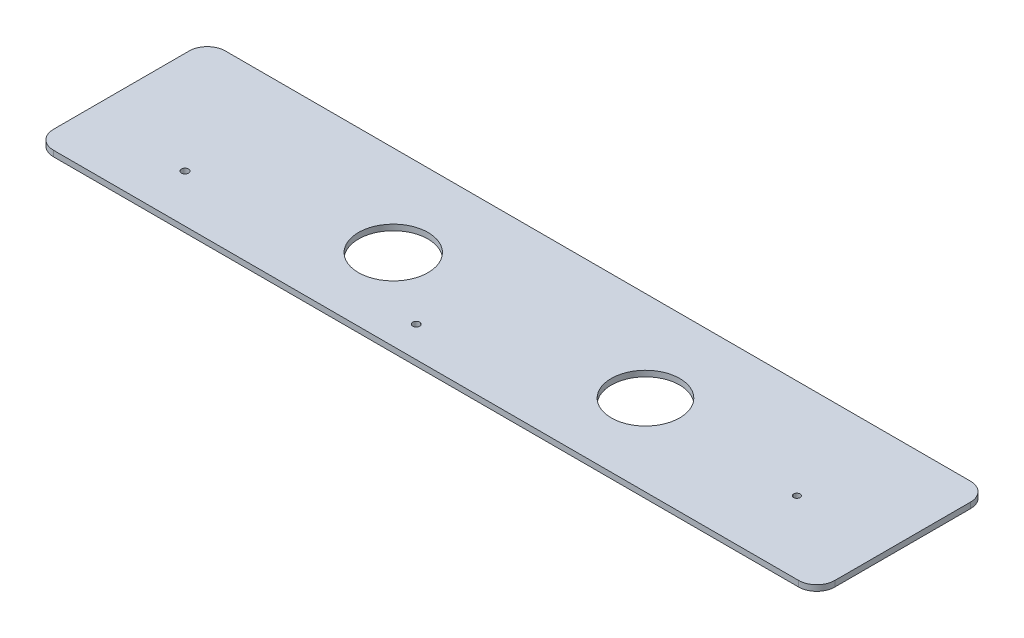
from build123d import *

# Parameters (mm, degrees)
SKETCH1_W           = 431.8
SKETCH1_H           = 95
SKETCH1_R           = 2
SKETCH1_R_2         = 1.94945
SKETCH1_R_3         = 19.23528322
SKETCH1_R_4         = 18.898143468
SKETCH1_R_5         = 1.770184209
BOSS_EXTRUDE1_DEPTH = 3.175
FILLET1_R           = 10


with BuildPart() as part:
    # Sketch1 → Boss-Extrude1 (new body)
    with BuildSketch(Plane(origin=(0, 0, 0), x_dir=(1, 0, 0), z_dir=(0, 1, 0))):
        with Locations((213.767466267, 47.5)):
            Rectangle(SKETCH1_W, SKETCH1_H)
        with Locations((54.191771613, 26.368316596)):
            Circle(SKETCH1_R, mode=Mode.SUBTRACT)
        with Locations((191.365563911, 16.995054431)):
            Circle(SKETCH1_R_2, mode=Mode.SUBTRACT)
        with Locations((150.735788138, 44.916344224)):
            Circle(SKETCH1_R_3, mode=Mode.SUBTRACT)
        with Locations((290.116990511, 44.912341135)):
            Circle(SKETCH1_R_4, mode=Mode.SUBTRACT)
        with Locations((378.667466267, 40.050297191)):
            Circle(SKETCH1_R_5, mode=Mode.SUBTRACT)
    extrude(amount=BOSS_EXTRUDE1_DEPTH)

    # Fillet1
    fillet1_edges = [part.edges().sort_by_distance(p)[0] for p in [
        (429.667466267, 1.5875, -95),
        (429.667466267, 1.5875, 0),
        (-2.132533733, 1.5875, 0),
        (-2.132533733, 1.5875, -95),
    ]]
    fillet(fillet1_edges, radius=FILLET1_R)


solid = part.part
